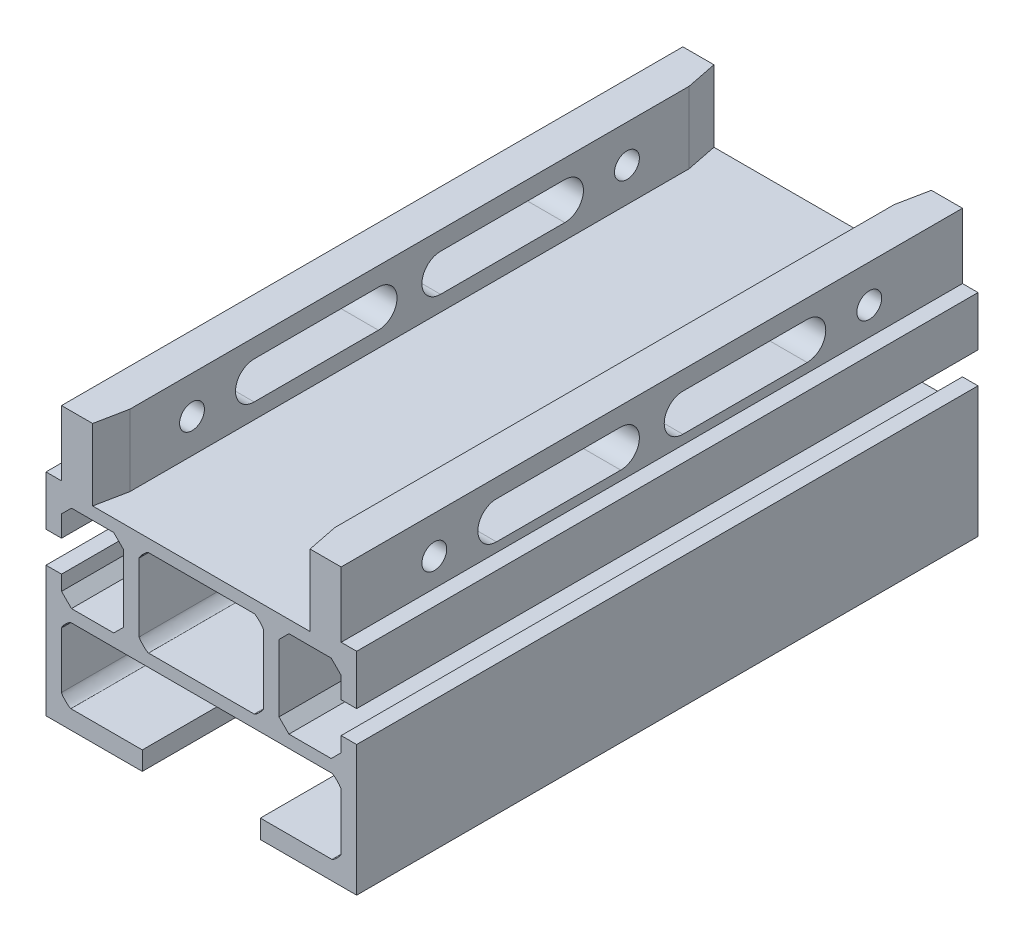
from build123d import *
from OCP.BRepFilletAPI import BRepFilletAPI_MakeChamfer

# Parameters (mm, degrees)
SCHIZZO1_W                   = 20
SCHIZZO1_H                   = 14
ESTRUSIONE_ESTRUSIONE1_DEPTH = 100
RACCORDO1_SIZE               = 1.5
SMUSSO1_SIZE                 = 1.6
SCHIZZO2_R                   = 2
TAGLIO_ESTRUSIONE1_DEPTH     = 100
SMUSSO2_SIZE                 = 5
SMUSSO2_SIZE2                = 1.000006128
SMUSSO3_SIZE                 = 5
SMUSSO3_SIZE2                = 1.000006128


with BuildPart() as part:
    # Schizzo1 → Estrusione-Estrusione1 (new body)
    with BuildSketch(Plane.XY):
        Polygon((-22.5, -9), (22.5, -9), (22.5, -21), (9.5, -21), (9.5, -24), (25, -24), (25, -3), (22.5, -3), (22.5, -7), (12.5, -7), (12.5, 7), (22.5, 7), (22.5, 2), (25, 2), (25, 10), (22.5, 10), (22.5, 20.5), (16.5, 20.5), (16.5, 9), (-16.5, 9), (-16.5, 20.5), (-22.5, 20.5), (-22.5, 10), (-25, 10), (-25, 2), (-22.5, 2), (-22.5, 7), (-12.5, 7), (-12.5, -7), (-22.5, -7), (-22.5, -3), (-25, -3), (-25, -24), (-9.5, -24), (-9.5, -21), (-22.5, -21), align=None)
        Rectangle(SCHIZZO1_W, SCHIZZO1_H, mode=Mode.SUBTRACT)
    extrude(amount=ESTRUSIONE_ESTRUSIONE1_DEPTH)

    # Raccordo1
    # a fillet whose section is not a circle: 1.5 mm, written as the material it adds along each edge
    with BuildSketch(Plane(origin=(-10, -7, 0), x_dir=(1, 0, 0), z_dir=(0, 0, 1)), Plane(origin=(10, 7, 0), x_dir=(-1, 0, 0), z_dir=(0, 0, 1)), Plane(origin=(10, -7, 0), x_dir=(0, 1, 0), z_dir=(0, 0, 1)), Plane(origin=(22.5, -21, 0), x_dir=(0, 1, 0), z_dir=(0, 0, 1)), Plane(origin=(22.5, -9, 0), x_dir=(-1, 0, 0), z_dir=(0, 0, 1)), Plane(origin=(-22.5, -21, 0), x_dir=(1, 0, 0), z_dir=(0, 0, 1))) as raccordo1_piece_1:
        with BuildLine():
            Bezier((RACCORDO1_SIZE, 0), (0, 0), (0, RACCORDO1_SIZE), weights=[1, 0.176470588, 1])
            Line((0, RACCORDO1_SIZE), (0, 0))
            Line((0, 0), (RACCORDO1_SIZE, 0))
        make_face()
    extrude(amount=100)
    with BuildSketch(Plane(origin=(-10, 7, 0), x_dir=(1, 0, 0), z_dir=(0, 0, 1)), Plane(origin=(-22.5, -9, 0), x_dir=(1, 0, 0), z_dir=(0, 0, 1))) as raccordo1_piece_2:
        with BuildLine():
            Bezier((RACCORDO1_SIZE, 0), (0, 0), (0, -RACCORDO1_SIZE), weights=[1, 0.176470588, 1])
            Line((0, -RACCORDO1_SIZE), (0, 0))
            Line((0, 0), (RACCORDO1_SIZE, 0))
        make_face()
    extrude(amount=100)

    # Smusso1
    smusso1_edges = [part.edges().sort_by_distance(p)[0] for p in [
        (22.5, 7, 50),
        (12.5, 7, 50),
        (12.5, -7, 50),
        (22.5, -7, 50),
        (-22.5, -7, 50),
        (-12.5, -7, 50),
        (-12.5, 7, 50),
        (-22.5, 7, 50),
    ]]
    chamfer(smusso1_edges, length=SMUSSO1_SIZE)

    # Schizzo2 → Taglio-Estrusione1 (cut)
    with BuildSketch(Plane.ZY.offset(22.5)):
        with Locations(Location((85, 14.5, 0), (0, 0, 270))):
            Circle(SCHIZZO2_R)
        with Locations(Location((15, 14.5, 0), (0, 0, 270))):
            Circle(SCHIZZO2_R)
        with BuildLine():
            Line((25, 17.5), (45, 17.5))
            ThreePointArc((45, 17.5), (48, 14.5), (45, 11.5))
            Line((45, 11.5), (25, 11.5))
            ThreePointArc((25, 11.5), (22, 14.5), (25, 17.5))
        make_face()
        with BuildLine():
            Line((55, 17.5), (75, 17.5))
            ThreePointArc((75, 17.5), (78, 14.5), (75, 11.5))
            Line((75, 11.5), (55, 11.5))
            ThreePointArc((55, 11.5), (52, 14.5), (55, 17.5))
        make_face()
    extrude(amount=-TAGLIO_ESTRUSIONE1_DEPTH, mode=Mode.SUBTRACT)

    # Smusso2: one chamfer whose edges measure the first distance from different faces: ONE call of the kernel's chamfer builder (chamfer() names one face for all edges)
    smusso2_edges_1 = [part.edges().sort_by_distance(p)[0] for p in [
        (16.5, 14.75, 100),
    ]]
    smusso2_side_1 = [part.faces().sort_by_distance(p)[0] for p in [
        (16.5, 14.847088672, 50),
    ]]
    smusso2_edges_2 = [part.edges().sort_by_distance(p)[0] for p in [
        (-16.5, 14.75, 100),
    ]]
    smusso2_side_2 = [part.faces().sort_by_distance(p)[0] for p in [
        (-16.5, 14.847088672, 50),
    ]]
    smusso2 = BRepFilletAPI_MakeChamfer(part.part.solid().wrapped)
    for e in smusso2_edges_1:
        smusso2.Add(SMUSSO2_SIZE, SMUSSO2_SIZE2, e.wrapped, smusso2_side_1[0].wrapped)  # the first distance lies on this face
    for e in smusso2_edges_2:
        smusso2.Add(SMUSSO2_SIZE, SMUSSO2_SIZE2, e.wrapped, smusso2_side_2[0].wrapped)  # the first distance lies on this face
    add(Compound.cast(smusso2.Shape()), mode=Mode.REPLACE)

    # Smusso3: one chamfer whose edges measure the first distance from different faces: ONE call of the kernel's chamfer builder (chamfer() names one face for all edges)
    smusso3_edges_1 = [part.edges().sort_by_distance(p)[0] for p in [
        (-16.5, 14.75, 0),
    ]]
    smusso3_side_1 = [part.faces().sort_by_distance(p)[0] for p in [
        (-16.5, 9.956935212, 47.5),
    ]]
    smusso3_edges_2 = [part.edges().sort_by_distance(p)[0] for p in [
        (16.5, 14.75, 0),
    ]]
    smusso3_side_2 = [part.faces().sort_by_distance(p)[0] for p in [
        (16.5, 19.543064788, 47.5),
    ]]
    smusso3 = BRepFilletAPI_MakeChamfer(part.part.solid().wrapped)
    for e in smusso3_edges_1:
        smusso3.Add(SMUSSO3_SIZE, SMUSSO3_SIZE2, e.wrapped, smusso3_side_1[0].wrapped)  # the first distance lies on this face
    for e in smusso3_edges_2:
        smusso3.Add(SMUSSO3_SIZE, SMUSSO3_SIZE2, e.wrapped, smusso3_side_2[0].wrapped)  # the first distance lies on this face
    add(Compound.cast(smusso3.Shape()), mode=Mode.REPLACE)


solid = part.part
